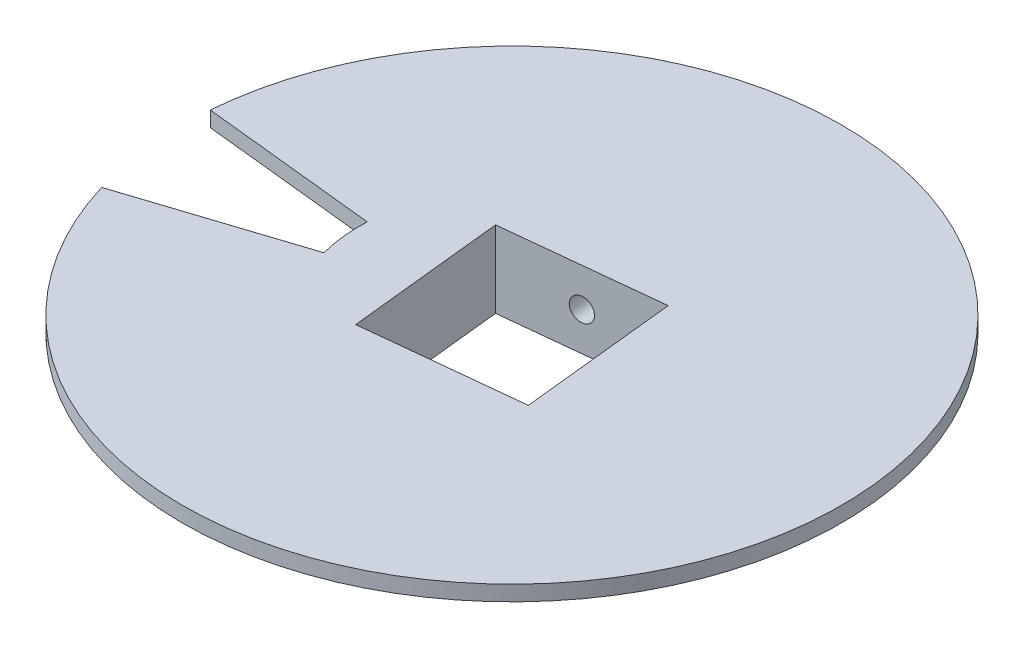
from build123d import *

# Parameters (mm, degrees)
SKETCH7_W               = 86
SKETCH7_H               = 4
CUT_EXTRUDE3_DEPTH      = 122.688125961
CUT_EXTRUDE3_DEPTH_BACK = 122.688125961
SKETCH9_R               = 40
CUT_EXTRUDE4_DEPTH      = 122.688125961
SKETCH10_R              = 40
BOSS_EXTRUDE1_DEPTH     = 20
CUT_EXTRUDE7_DEPTH      = 124.255831505
CUT_EXTRUDE8_DEPTH      = 140.597641687
CUT_EXTRUDE8_DEPTH_BACK = 140.597641687
SKETCH15_R              = 3


with BuildPart() as part:
    # Sketch7 → Revolve4 (revolve)
    with BuildSketch(Plane.XY):
        with Locations((-43, -2)):
            Rectangle(SKETCH7_W, SKETCH7_H)
    revolve(axis=Axis((0, 0, 0), (0, -1, 0)))

    # Sketch9 → Cut-Extrude3 (cut, two sides: drawn at the far end of the back side and taken through both)
    with BuildSketch(Plane(origin=(0, 0, 0), x_dir=(1, 0, 0), z_dir=(0, 1, 0)).offset(-CUT_EXTRUDE3_DEPTH_BACK)):
        Circle(SKETCH9_R)
    extrude(amount=CUT_EXTRUDE3_DEPTH + CUT_EXTRUDE3_DEPTH_BACK, mode=Mode.SUBTRACT)

    # Sketch1 → Cut-Extrude4 (cut, through all)
    with BuildSketch(Plane(origin=(0, 0, 0), x_dir=(1, 0, 0), z_dir=(0, 1, 0))):
        with BuildLine():
            Line((-86.191983256, -25.902548569), (-9.566772234, -1.00550828))
            Line((-9.566772234, -1.00550828), (-89.693924294, 7.416194762))
            ThreePointArc((-89.693924294, 7.416194762), (-89.506970583, -9.407561694), (-86.191983256, -25.902548569))
        make_face()
    extrude(amount=-CUT_EXTRUDE4_DEPTH, mode=Mode.SUBTRACT)

    # Sketch10 → Boss-Extrude1 (add)
    with BuildSketch(Plane(origin=(0, 0, 0), x_dir=(-1, 0, 0), z_dir=(0, -1, 0))):
        Circle(SKETCH10_R)
    extrude(amount=BOSS_EXTRUDE1_DEPTH)

    # Sketch14 → Cut-Extrude7 (cut, through all)
    with BuildSketch(Plane(origin=(0, 0, 0), x_dir=(1, 0, 0), z_dir=(0, 1, 0))):
        Polygon((22.530532352, -18.244865358), (18.244865358, 22.530532352), (-22.530532352, 18.244865358), (-18.244865358, -22.530532352), align=None)
    extrude(amount=-CUT_EXTRUDE7_DEPTH, mode=Mode.SUBTRACT)

    # Sketch15 → Cut-Extrude8 (cut, two sides: drawn at the far end of the back side and taken through both)
    with BuildSketch(Plane(origin=(-2.142833497, 0, -20.387698855), x_dir=(0.9945218953682733, 0, -0.10452846326765386), z_dir=(0.10452846326765386, 0, 0.9945218953682733)).offset(-CUT_EXTRUDE8_DEPTH_BACK)):
        with Locations((0, -10)):
            Circle(SKETCH15_R)
    extrude(amount=CUT_EXTRUDE8_DEPTH + CUT_EXTRUDE8_DEPTH_BACK, mode=Mode.SUBTRACT)


solid = part.part
